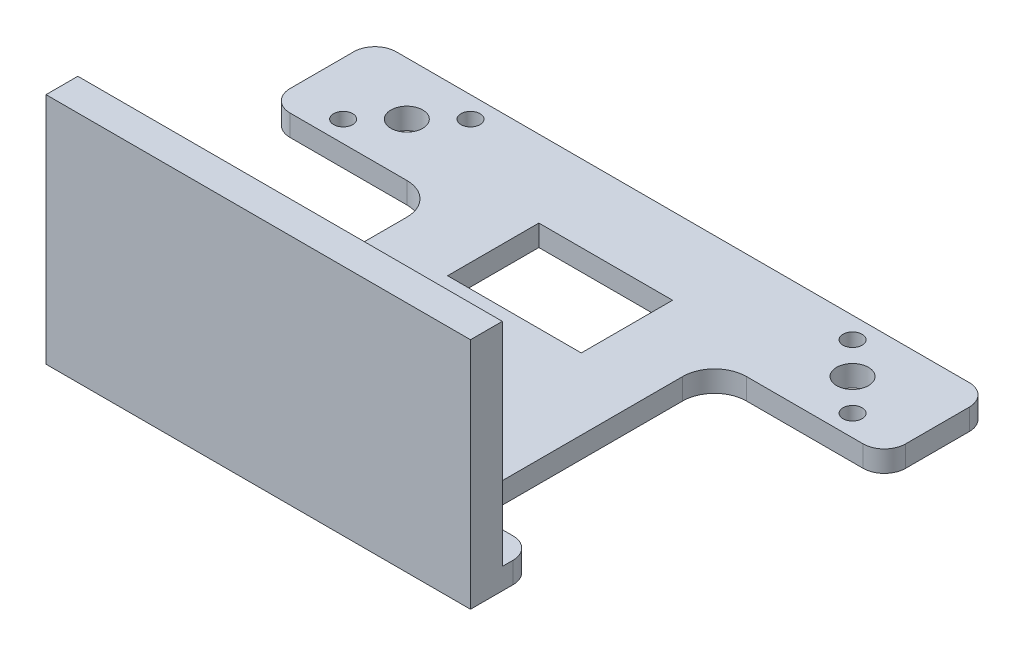
from build123d import *

# Parameters (mm, degrees)
SKIZZE1_R                       = 7.5
SKIZZE1_R_2                     = 4.5
SKIZZE1_W                       = 63
SKIZZE1_H                       = 43.01
AUFSATZ_LINEAR_AUSTRAGEN1_DEPTH = 10
SKIZZE3_W                       = 200
SKIZZE3_H                       = 15
AUFSATZ_LINEAR_AUSTRAGEN2_DEPTH = 100
VERST_RKUNGSRIPPE1_REACH        = 209.666
SKIZZE7_WALL_W                  = 509.987773778
SKIZZE7_WALL_H                  = 10


with BuildPart() as part:
    # Skizze1 → Aufsatz-Linear austragen1 (new body)
    with BuildSketch(Plane(origin=(0, 0, 0), x_dir=(1, 0, 0), z_dir=(0, 1, 0))):
        with BuildLine():
            Line((-135, 100), (135, 100))
            ThreePointArc((135, 100), (142.071067812, 97.071067812), (145, 90))
            Line((145, 90), (145, 60))
            ThreePointArc((145, 60), (142.071067812, 52.928932188), (135, 50))
            Line((135, 50), (80, 50))
            ThreePointArc((80, 50), (69.393398282, 45.606601718), (65, 35))
            Line((65, 35), (65, -55))
            ThreePointArc((65, -55), (69.393398282, -65.606601718), (80, -70))
            Line((80, -70), (90, -70))
            ThreePointArc((90, -70), (97.071067812, -72.928932188), (100, -80))
            Line((100, -80), (100, -90))
            Line((100, -90), (100, -100))
            Line((100, -100), (90, -100))
            Line((90, -100), (-90, -100))
            Line((-90, -100), (-100, -100))
            Line((-100, -100), (-100, -90))
            Line((-100, -90), (-100, -80))
            ThreePointArc((-100, -80), (-97.071067812, -72.928932188), (-90, -70))
            Line((-90, -70), (-80, -70))
            ThreePointArc((-80, -70), (-69.393398282, -65.606601718), (-65, -55))
            Line((-65, -55), (-65, 35))
            ThreePointArc((-65, 35), (-69.393398282, 45.606601718), (-80, 50))
            Line((-80, 50), (-135, 50))
            ThreePointArc((-135, 50), (-142.071067812, 52.928932188), (-145, 60))
            Line((-145, 60), (-145, 90))
            ThreePointArc((-145, 90), (-142.071067812, 97.071067812), (-135, 100))
        make_face()
        with Locations((-105, 75)):
            Circle(SKIZZE1_R, mode=Mode.SUBTRACT)
        with Locations((105, 75)):
            Circle(SKIZZE1_R, mode=Mode.SUBTRACT)
        with Locations((-90, 90)):
            Circle(SKIZZE1_R_2, mode=Mode.SUBTRACT)
        with Locations((-120, 60)):
            Circle(SKIZZE1_R_2, mode=Mode.SUBTRACT)
        with Locations((90, 90)):
            Circle(SKIZZE1_R_2, mode=Mode.SUBTRACT)
        with Locations((120, 60)):
            Circle(SKIZZE1_R_2, mode=Mode.SUBTRACT)
        with Locations((0, 42.21)):
            Rectangle(SKIZZE1_W, SKIZZE1_H, mode=Mode.SUBTRACT)
    extrude(amount=AUFSATZ_LINEAR_AUSTRAGEN1_DEPTH)

    # Skizze3 → Aufsatz-Linear austragen2 (add)
    with BuildSketch(Plane(origin=(0, 10, 0), x_dir=(1, 0, 0), z_dir=(0, 1, 0))):
        with Locations((0, -92.5)):
            Rectangle(SKIZZE3_W, SKIZZE3_H)
    extrude(amount=AUFSATZ_LINEAR_AUSTRAGEN2_DEPTH)

    # Skizze7 wall → Verstärkungsrippe1 (add, up to next)
    with BuildSketch(Plane(origin=(0, 40.353096771, 50), x_dir=(0, -0.655174118537, -0.755477911259), z_dir=(0, 0.755477911259, -0.655174118537)), mode=Mode.PRIVATE) as verst_rkungsrippe1_sk1:
        Rectangle(SKIZZE7_WALL_W, SKIZZE7_WALL_H)
    verst_rkungsrippe1_tool1 = extrude(verst_rkungsrippe1_sk1.sketch, amount=-VERST_RKUNGSRIPPE1_REACH, mode=Mode.PRIVATE) - part.part
    add(verst_rkungsrippe1_tool1.solids().sort_by_distance((0, 40.353096771, 50))[0])


solid = part.part
